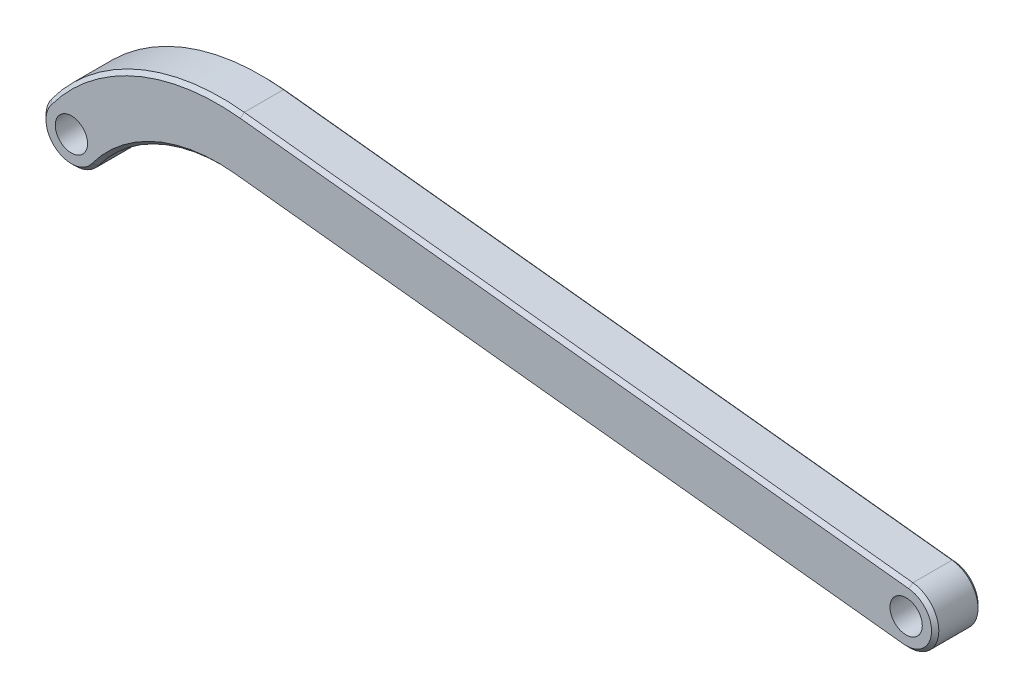
from build123d import *

# Parameters (mm, degrees)
SKETCH2_R           = 2.225
BOSS_EXTRUDE1_DEPTH = 6.4
CHAMFER1_SIZE       = 0.5


with BuildPart() as part:
    # Sketch2 → Boss-Extrude1 (new body)
    with BuildSketch(Plane.XY):
        with BuildLine():
            ThreePointArc((3.226185769, -2.364682935), (11.702669886, 4.440815643), (22.446269754, 6.096308238))
            Line((22.446269754, 6.096308238), (114.565217391, -3.976300301))
            ThreePointArc((114.565217391, -3.976300301), (118.976300301, -0.434782609), (115.434782609, 3.976300301))
            Line((115.434782609, 3.976300301), (23.315834971, 14.04890884))
            ThreePointArc((23.315834971, 14.04890884), (8.479435153, 11.762752399), (-3.226185769, 2.364682935))
            ThreePointArc((-3.226185769, 2.364682935), (-2.364682935, -3.226185769), (3.226185769, -2.364682935))
        make_face()
        Circle(SKETCH2_R, mode=Mode.SUBTRACT)
        with Locations((115, 0)):
            Circle(SKETCH2_R, mode=Mode.SUBTRACT)
    extrude(amount=BOSS_EXTRUDE1_DEPTH)

    # Chamfer1
    chamfer1_edges = [part.edges().sort_by_distance(p)[0] for p in [
        (11.702669886, 4.440815643, 0),
        (-2.364682935, -3.226185769, 0),
        (68.505743573, 1.060003968, 0),
        (8.479435153, 11.762752399, 0),
        (118.976300301, -0.434782609, 0),
        (69.37530879, 9.01260457, 0),
        (11.702669886, 4.440815643, 6.4),
        (-2.364682935, -3.226185769, 6.4),
        (68.505743573, 1.060003968, 6.4),
        (8.479435153, 11.762752399, 6.4),
        (118.976300301, -0.434782609, 6.4),
        (69.37530879, 9.01260457, 6.4),
    ]]
    chamfer(chamfer1_edges, length=CHAMFER1_SIZE)


solid = part.part
